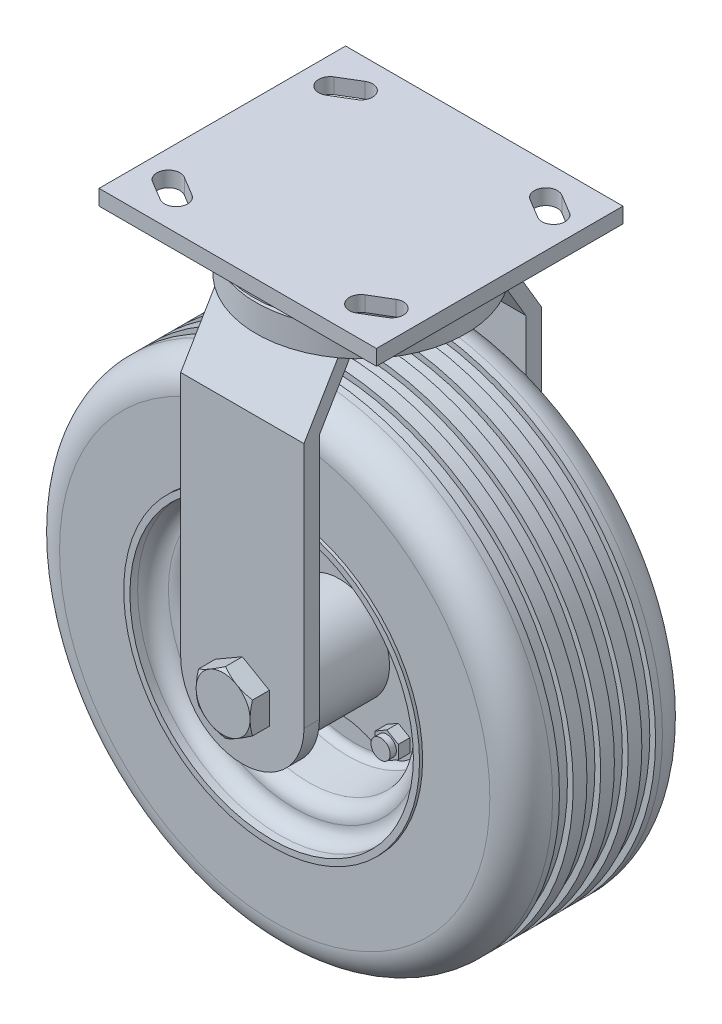
from build123d import *

# Parameters (mm, degrees)
SKETCH1_W               = 114.3
SKETCH1_H               = 6.35
BOSS_EXTRUDE1_DEPTH     = 50.8
F_1_2_HOLES_DEPTH       = 77.727341932
BOSS_EXTRUDE5_DEPTH     = 6.35
BOSS_EXTRUDE6_DEPTH     = 4.7625
SKETCH15_R              = 3.96875
BOSS_EXTRUDE7_DEPTH     = 2.54
SKETCH16_R              = 6.35
BOSS_EXTRUDE8_DEPTH     = 4.7625
SKETCH7_W               = 127
SKETCH7_H               = 97.79
BOSS_EXTRUDE2_DEPTH     = 226.8474
CUT_EXTRUDE1_START      = -97.79
CUT_EXTRUDE1_DEPTH      = 97.79
CUT_EXTRUDE3_DEPTH      = 184.650814981
CUT_EXTRUDE3_DEPTH_BACK = 184.650814981
SKETCH9_OUTSIDE_W       = 171.756
SKETCH9_OUTSIDE_H       = 324.156
BOSS_EXTRUDE3_DEPTH     = 7.9375
SKETCH11_OUTSIDE_W      = 1295.56
SKETCH11_OUTSIDE_H      = 1346.36
SKETCH11_OUTSIDE_R      = 11.1125
CUT_EXTRUDE4_DEPTH      = 294.978426175
CUT_EXTRUDE4_DRAFT      = -60
SKETCH12_R              = 10.795
BOSS_EXTRUDE4_DEPTH     = 85.09


# Read off the part's stored shape, not the designer's step: Cut-Extrude1
with BuildPart() as part:
    # Sketch1 → Boss-Extrude1 (new, symmetric)
    with BuildSketch(Plane.XY):
        with Locations((0, -3.175)):
            Rectangle(SKETCH1_W, SKETCH1_H)
    extrude(amount=BOSS_EXTRUDE1_DEPTH, both=True)

    # Sketch2 → 1-2 holes (cut, through all)
    with BuildSketch(Plane(origin=(0, 0, 0), x_dir=(1, 0, 0), z_dir=(0, 1, 0))):
        with BuildLine():
            Line((-35.649713965, 34.016189941), (-43.587213965, 29.253689941))
            ThreePointArc((-43.587213965, 29.253689941), (-50.121310059, 30.887213965), (-48.487786035, 37.421310059))
            Line((-48.487786035, 37.421310059), (-40.550286035, 42.183810059))
            ThreePointArc((-40.550286035, 42.183810059), (-34.016189941, 40.550286035), (-35.649713965, 34.016189941))
        make_face()
        with BuildLine():
            Line((-35.649713965, -34.016189941), (-43.587213965, -29.253689941))
            ThreePointArc((-43.587213965, -29.253689941), (-50.121310059, -30.887213965), (-48.487786035, -37.421310059))
            Line((-48.487786035, -37.421310059), (-40.550286035, -42.183810059))
            ThreePointArc((-40.550286035, -42.183810059), (-34.016189941, -40.550286035), (-35.649713965, -34.016189941))
        make_face()
        with BuildLine():
            Line((35.649713965, 34.016189941), (43.587213965, 29.253689941))
            ThreePointArc((43.587213965, 29.253689941), (50.121310059, 30.887213965), (48.487786035, 37.421310059))
            Line((48.487786035, 37.421310059), (40.550286035, 42.183810059))
            ThreePointArc((40.550286035, 42.183810059), (34.016189941, 40.550286035), (35.649713965, 34.016189941))
        make_face()
        with BuildLine():
            Line((35.649713965, -34.016189941), (43.587213965, -29.253689941))
            ThreePointArc((43.587213965, -29.253689941), (50.121310059, -30.887213965), (48.487786035, -37.421310059))
            Line((48.487786035, -37.421310059), (40.550286035, -42.183810059))
            ThreePointArc((40.550286035, -42.183810059), (34.016189941, -40.550286035), (35.649713965, -34.016189941))
        make_face()
    extrude(amount=-F_1_2_HOLES_DEPTH, mode=Mode.SUBTRACT)


with BuildPart() as body_2:
    # Sketch4 → Revolve1 (revolve)
    with BuildSketch(Plane.XY, mode=Mode.PRIVATE) as revolve1_sk:
        Polygon((0, -27.1526), (43.18, -27.1526), (43.18, -16.0401), (40.64, -16.0401), (40.64, -13.5001), (44.45, -13.5001), (44.45, -6.35), (0, -6.35), align=None)
    revolve(revolve1_sk.sketch.rotate(Axis((0, -6.35, 0), (0, -1, 0)), 180), axis=Axis((0, -6.35, 0), (0, -1, 0)))


with BuildPart() as body_3:
    # Sketch6 → Revolve2 (revolve)
    with BuildSketch(Plane(origin=(0, 0, 0), x_dir=(0, 0, -1), z_dir=(1, 0, 0)), mode=Mode.PRIVATE) as revolve2_sk:
        with BuildLine():
            Line((-35.56, -91.44), (-35.56, -63.730909091))
            ThreePointArc((-35.56, -63.730909091), (-31.772624414, -54.587375586), (-22.629090909, -50.8))
            Line((-22.629090909, -50.8), (-19.800454545, -50.8))
            Line((-19.800454545, -50.8), (-19.800454545, -53.18125))
            Line((-19.800454545, -53.18125), (-14.143181818, -53.18125))
            Line((-14.143181818, -53.18125), (-14.143181818, -50.8))
            Line((-14.143181818, -50.8), (-8.485909091, -50.8))
            Line((-8.485909091, -50.8), (-8.485909091, -53.18125))
            Line((-8.485909091, -53.18125), (-2.828636364, -53.18125))
            Line((-2.828636364, -53.18125), (-2.828636364, -50.8))
            Line((-2.828636364, -50.8), (2.828636364, -50.8))
            Line((2.828636364, -50.8), (2.828636364, -53.18125))
            Line((2.828636364, -53.18125), (8.485909091, -53.18125))
            Line((8.485909091, -53.18125), (8.485909091, -50.8))
            Line((8.485909091, -50.8), (14.143181818, -50.8))
            Line((14.143181818, -50.8), (14.143181818, -53.18125))
            Line((14.143181818, -53.18125), (19.800454545, -53.18125))
            Line((19.800454545, -53.18125), (19.800454545, -50.8))
            Line((19.800454545, -50.8), (22.629090909, -50.8))
            ThreePointArc((22.629090909, -50.8), (31.772624414, -54.587375586), (35.56, -63.730909091))
            Line((35.56, -63.730909091), (35.56, -91.44))
            Line((35.56, -91.44), (36.83, -91.44))
            Line((36.83, -91.44), (36.83, -93.98))
            Line((36.83, -93.98), (33.655, -93.98))
            ThreePointArc((33.655, -93.98), (29.164871939, -95.839871939), (27.305, -100.33))
            ThreePointArc((27.305, -100.33), (25.636711089, -104.619997818), (21.508438966, -106.655836333))
            Line((21.508438966, -106.655836333), (5.438280517, -108.061793018))
            ThreePointArc((5.438280517, -108.061793018), (3.374144456, -109.079712276), (2.54, -111.224711185))
            Line((2.54, -111.224711185), (2.54, -131.7625))
            Line((2.54, -131.7625), (36.83, -131.7625))
            Line((36.83, -131.7625), (40.005, -131.7625))
            Line((40.005, -131.7625), (40.005, -152.4))
            Line((40.005, -152.4), (-40.005, -152.4))
            Line((-40.005, -152.4), (-40.005, -131.7625))
            Line((-40.005, -131.7625), (-36.83, -131.7625))
            Line((-36.83, -131.7625), (-2.54, -131.7625))
            Line((-2.54, -131.7625), (-2.54, -111.224711185))
            ThreePointArc((-2.54, -111.224711185), (-3.374144456, -109.079712276), (-5.438280517, -108.061793018))
            Line((-5.438280517, -108.061793018), (-21.508438966, -106.655836333))
            ThreePointArc((-21.508438966, -106.655836333), (-25.636711089, -104.619997818), (-27.305, -100.33))
            ThreePointArc((-27.305, -100.33), (-29.164871939, -95.839871939), (-33.655, -93.98))
            Line((-33.655, -93.98), (-36.83, -93.98))
            Line((-36.83, -93.98), (-36.83, -91.44))
            Line((-36.83, -91.44), (-35.56, -91.44))
        make_face()
    revolve(revolve2_sk.sketch.rotate(Axis((0, -152.4, 111.145303652), (0, 0, -1)), 90), axis=Axis((0, -152.4, 111.145303652), (0, 0, -1)))

    # Sketch13 → Boss-Extrude5 (add)
    with BuildSketch(Plane.XY.offset(2.54)):
        with BuildLine():
            ThreePointArc((-31.191813407, -138.062089407), (-29.115325939, -123.284674061), (-14.337910593, -121.208186593))
            ThreePointArc((-14.337910593, -121.208186593), (0, -124.916570395), (14.337910593, -121.208186593))
            ThreePointArc((14.337910593, -121.208186593), (29.115325939, -123.284674061), (31.191813407, -138.062089407))
            ThreePointArc((31.191813407, -138.062089407), (27.483429605, -152.4), (31.191813407, -166.737910593))
            ThreePointArc((31.191813407, -166.737910593), (29.115325939, -181.515325939), (14.337910593, -183.591813407))
            ThreePointArc((14.337910593, -183.591813407), (0, -179.883429605), (-14.337910593, -183.591813407))
            ThreePointArc((-14.337910593, -183.591813407), (-29.115325939, -181.515325939), (-31.191813407, -166.737910593))
            ThreePointArc((-31.191813407, -166.737910593), (-27.483429605, -152.4), (-31.191813407, -138.062089407))
        make_face()
    extrude(amount=BOSS_EXTRUDE5_DEPTH)

    # Sketch14 → Boss-Extrude6 (add)
    with BuildSketch(Plane.XY.offset(8.89)):
        Polygon((-24.274522691, -133.624738623), (-19.512022691, -130.875107966), (-19.512022691, -125.375846652), (-24.274522691, -122.626215995), (-29.037022691, -125.375846652), (-29.037022691, -130.875107966), align=None)
        Polygon((29.037022691, -130.875107966), (24.274522691, -133.624738623), (19.512022691, -130.875107966), (19.512022691, -125.375846652), (24.274522691, -122.626215995), (29.037022691, -125.375846652), align=None)
        Polygon((24.274522691, -171.175261377), (19.512022691, -173.924892034), (19.512022691, -179.424153348), (24.274522691, -182.173784005), (29.037022691, -179.424153348), (29.037022691, -173.924892034), align=None)
        Polygon((-29.037022691, -173.924892034), (-24.274522691, -171.175261377), (-19.512022691, -173.924892034), (-19.512022691, -179.424153348), (-24.274522691, -182.173784005), (-29.037022691, -179.424153348), align=None)
    extrude(amount=BOSS_EXTRUDE6_DEPTH)

    # Sketch15 → Boss-Extrude7 (add)
    with BuildSketch(Plane.XY.offset(13.6525)):
        with Locations((-24.274522691, -128.125477309)):
            Circle(SKETCH15_R)
        with Locations(Location((24.274522691, -128.125477309, 0), (0, 0, 180))):
            Circle(SKETCH15_R)
        with Locations(Location((-24.274522691, -176.674522691, 0), (0, 0, 180))):
            Circle(SKETCH15_R)
        with Locations((24.274522691, -176.674522691)):
            Circle(SKETCH15_R)
    extrude(amount=BOSS_EXTRUDE7_DEPTH)

    # Sketch16 → Boss-Extrude8 (add)
    with BuildSketch(Plane(origin=(0, 0, -2.54), x_dir=(-1, 0, 0), z_dir=(0, 0, -1))):
        with Locations(Location((-24.274522691, -128.125477309, 0), (0, 0, 180))):
            Circle(SKETCH16_R)
        with Locations(Location((24.274522691, -128.125477309, 0), (0, 0, 180))):
            Circle(SKETCH16_R)
        with Locations(Location((24.274522691, -176.674522691, 0), (0, 0, 180))):
            Circle(SKETCH16_R)
        with Locations(Location((-24.274522691, -176.674522691, 0), (0, 0, 180))):
            Circle(SKETCH16_R)
    extrude(amount=BOSS_EXTRUDE8_DEPTH)


with BuildPart() as body_4:
    # Sketch7 → Boss-Extrude2 (new body)
    with BuildSketch(Plane.XZ.offset(27.1526)):
        with Locations((-38.1, 0)):
            Rectangle(SKETCH7_W, SKETCH7_H)
    extrude(amount=BOSS_EXTRUDE2_DEPTH)

    # Cut-Extrude1 outline → Cut-Extrude1 (cut)
    with BuildSketch(Plane.XY.offset(48.895).offset(CUT_EXTRUDE1_START)):
        with BuildLine():
            Line((25.4, -254), (25.4, -152.4))
            ThreePointArc((25.4, -152.4), (0, -177.8), (-25.4, -152.4))
            Line((-25.4, -152.4), (-25.4, -27.1526))
            Line((-25.4, -27.1526), (-101.6, -27.1526))
            Line((-101.6, -27.1526), (-101.6, -254))
            Line((-101.6, -254), (25.4, -254))
        make_face()
    extrude(amount=CUT_EXTRUDE1_DEPTH, mode=Mode.SUBTRACT)

    # Sketch9 outside → Cut-Extrude3 (cut, two sides: drawn at the far end of the back side and taken through both)
    with BuildSketch(Plane(origin=(0, -144.306693689, 0), x_dir=(0, 0, -1), z_dir=(-1, 0, 0)).offset(-CUT_EXTRUDE3_DEPTH_BACK)):
        with Locations((0, -17.307)):
            Rectangle(SKETCH9_OUTSIDE_W, SKETCH9_OUTSIDE_H)
        Polygon((48.895, 109.693306311), (48.895, -93.506693689), (34.919226796, -117.154093689), (28.569226796, -117.154093689), (42.545, -93.506693689), (42.545, 109.693306311), align=None, mode=Mode.SUBTRACT)
        Polygon((-28.569226796, -117.154093689), (-34.919226796, -117.154093689), (-48.895, -93.506693689), (-48.895, 109.693306311), (-42.545, 109.693306311), (-42.545, -93.506693689), align=None, mode=Mode.SUBTRACT)
    extrude(amount=CUT_EXTRUDE3_DEPTH + CUT_EXTRUDE3_DEPTH_BACK, mode=Mode.SUBTRACT)


with BuildPart() as cut_extrude3_piece_1:
    # of the separate pieces the step leaves, piece 1, a body of its own (cut_extrude3_pieces)
    add(body_4.part.solids().sort_by_distance((25.4, -27.1526, -34.919226796))[0])



with BuildPart() as cut_extrude3_piece_2:
    # of the separate pieces the step leaves, piece 2, a body of its own (cut_extrude3_pieces)
    add(body_4.part.solids().sort_by_distance((25.4, -50.8, 48.895))[0])


with BuildPart() as body_6:
    # Sketch10 → Boss-Extrude3 (new body)
    with BuildSketch(Plane.XY.offset(48.895)):
        Polygon((0, -139.568390267), (-11.1125, -145.984195134), (-11.1125, -158.815804866), (0, -165.231609733), (11.1125, -158.815804866), (11.1125, -145.984195134), align=None)
    extrude(amount=BOSS_EXTRUDE3_DEPTH)


with BuildPart() as cut_extrude4_tool:
    # Sketch11 outside → Cut-Extrude4 (with draft: the straight prism first)
    with BuildSketch(Plane.XY.offset(56.8325)):
        with Locations((0, -127)):
            Rectangle(SKETCH11_OUTSIDE_W, SKETCH11_OUTSIDE_H)
        with Locations((0, -152.4)):
            Circle(SKETCH11_OUTSIDE_R, mode=Mode.SUBTRACT)
    extrude(amount=-CUT_EXTRUDE4_DEPTH)
    # Cut-Extrude4: the draft: its side faces are tilted about the plane it starts from
    cut_extrude4_sides = [cut_extrude4_tool.faces().sort_by_distance(p)[0] for p in [
        (0, -800.18, -90.656713087),
        (647.78, -127, -90.656713087),
        (0, 546.18, -90.656713087),
        (-647.78, -127, -90.656713087),
        (-11.1125, -152.4, -90.656713087),
    ]]
    draft(cut_extrude4_sides, Plane.XY.offset(56.8325), CUT_EXTRUDE4_DRAFT)


with BuildPart() as body_6_1:
    add(body_6.part)

    # Cut-Extrude4: cut by cut_extrude4_tool
    add(cut_extrude4_tool.part, mode=Mode.SUBTRACT)


with BuildPart() as body_7:
    # Mirror1: mirrored copy
    add(body_6_1.part.mirror(Plane.XY))


with BuildPart() as cut_extrude3_piece_1_1:
    add(cut_extrude3_piece_1.part)

    add(cut_extrude3_piece_2.part)  # Boss-Extrude4 merges Cut-Extrude3 piece 2
    # Sketch12 → Boss-Extrude4 (add)
    with BuildSketch(Plane.XY.offset(-42.545)):
        with Locations(Location((0, -152.4, 0), (0, 0, 180))):
            Circle(SKETCH12_R)
    extrude(amount=BOSS_EXTRUDE4_DEPTH)

    # Combine1: union body 7, body 6, body 2, part
    add(body_7.part)
    add(body_6_1.part)
    add(body_2.part)
    add(part.part)


solid = Compound([body_3.part, cut_extrude3_piece_1_1.part])
